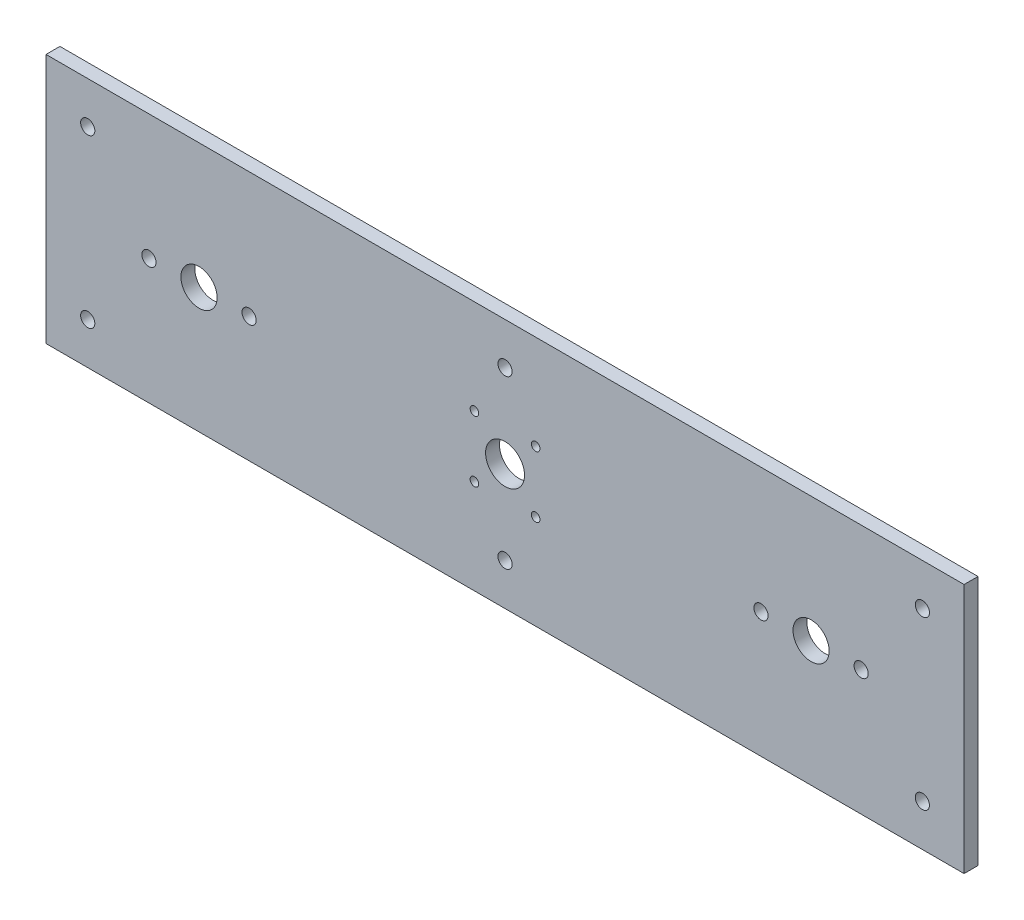
from build123d import *

# Parameters (mm, degrees)
SKETCH1_W           = 330
SKETCH1_H           = 90
BOSS_EXTRUDE1_DEPTH = 2.5
SKETCH2_R           = 2.55
CUT_EXTRUDE1_DEPTH  = 172.099386323
SKETCH3_R           = 6.5
SKETCH3_R_2         = 2.55
CUT_EXTRUDE2_DEPTH  = 172.099386323
SKETCH4_R           = 1.55
SKETCH4_R_2         = 7
CUT_EXTRUDE3_DEPTH  = 172.099386323


with BuildPart() as part:
    # Sketch1 → Boss-Extrude1 (new, symmetric)
    with BuildSketch(Plane.XY):
        Rectangle(SKETCH1_W, SKETCH1_H)
    extrude(amount=BOSS_EXTRUDE1_DEPTH, both=True)

    # Sketch2 → Cut-Extrude1 (cut, through all)
    with BuildSketch(Plane.XY.offset(2.5)):
        with Locations((150, 30)):
            Circle(SKETCH2_R)
        with Locations((150, -30)):
            Circle(SKETCH2_R)
        with Locations((0, 30)):
            Circle(SKETCH2_R)
        with Locations((0, -30)):
            Circle(SKETCH2_R)
        with Locations((-150, -30)):
            Circle(SKETCH2_R)
        with Locations((-150, 30)):
            Circle(SKETCH2_R)
    extrude(amount=-CUT_EXTRUDE1_DEPTH, mode=Mode.SUBTRACT)

    # Sketch3 → Cut-Extrude2 (cut, through all)
    with BuildSketch(Plane.XY.offset(2.5)):
        with Locations((-110, 0)):
            Circle(SKETCH3_R)
        with Locations((-92, 0)):
            Circle(SKETCH3_R_2)
        with Locations((-128, 0)):
            Circle(SKETCH3_R_2)
    cut_extrude2 = extrude(amount=-CUT_EXTRUDE2_DEPTH, mode=Mode.SUBTRACT)

    # Mirror1: Cut-Extrude2 across plane
    add(cut_extrude2.mirror(Plane(origin=(0, 0, 0), x_dir=(0, 0, 1), z_dir=(1, 0, 0))), mode=Mode.SUBTRACT)

    # Sketch4 → Cut-Extrude3 (cut, through all)
    with BuildSketch(Plane.XY.offset(2.5)):
        with Locations((11, 11)):
            Circle(SKETCH4_R)
        with Locations((11, -11)):
            Circle(SKETCH4_R)
        with Locations((-11, -11)):
            Circle(SKETCH4_R)
        with Locations((-11, 11)):
            Circle(SKETCH4_R)
        Circle(SKETCH4_R_2)
    extrude(amount=-CUT_EXTRUDE3_DEPTH, mode=Mode.SUBTRACT)


solid = part.part
